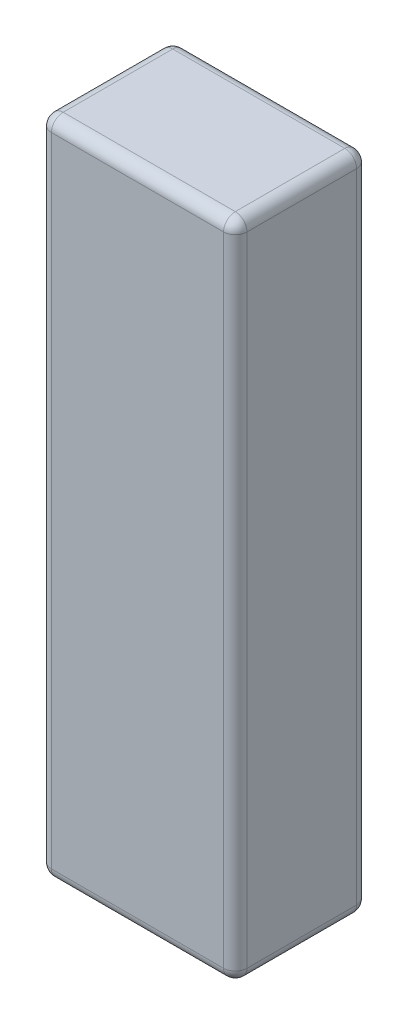
from build123d import *

# Parameters (mm, degrees)
SKETCH1_W           = 50
SKETCH1_H           = 169
BOSS_EXTRUDE1_DEPTH = 17
FILLET1_R           = 3


with BuildPart() as part:
    # Sketch1 → Boss-Extrude1 (new, symmetric)
    with BuildSketch(Plane.XY):
        Rectangle(SKETCH1_W, SKETCH1_H)
    extrude(amount=BOSS_EXTRUDE1_DEPTH, both=True)

    # Fillet1
    fillet1_edges = [part.edges().sort_by_distance(p)[0] for p in [
        (-25, 0, 17),
        (-25, 0, -17),
        (25, 0, 17),
        (25, 0, -17),
        (-25, -84.5, 0),
        (0, -84.5, 17),
        (25, -84.5, 0),
        (0, -84.5, -17),
        (25, 84.5, 0),
        (0, 84.5, 17),
        (-25, 84.5, 0),
        (0, 84.5, -17),
    ]]
    fillet(fillet1_edges, radius=FILLET1_R)


solid = part.part
